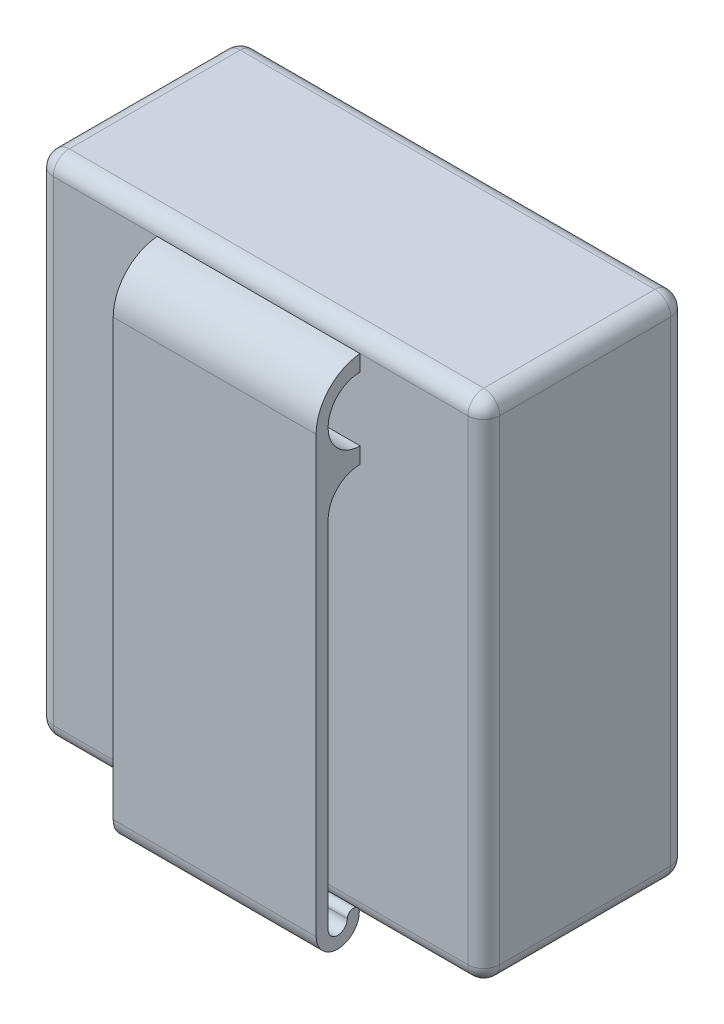
from build123d import *

# Parameters (mm, degrees)
SKETCH1_W           = 55.88
SKETCH1_H           = 63.5
BOSS_EXTRUDE1_DEPTH = 25.4
FILLET1_R           = 2
BOSS_EXTRUDE2_DEPTH = 25.4


with BuildPart() as part:
    # Sketch1 → Boss-Extrude1 (new body)
    with BuildSketch(Plane.XY):
        with Locations((27.94, 31.75)):
            Rectangle(SKETCH1_W, SKETCH1_H)
    extrude(amount=BOSS_EXTRUDE1_DEPTH)

    # Fillet1
    fillet1_edges = [part.edges().sort_by_distance(p)[0] for p in [
        (0, 0, 12.7),
        (55.88, 0, 12.7),
        (27.94, 0, 0),
        (55.88, 31.75, 0),
        (0, 31.75, 0),
        (55.88, 31.75, 25.4),
        (27.94, 0, 25.4),
        (0, 31.75, 25.4),
        (55.88, 63.5, 12.7),
        (27.94, 63.5, 25.4),
        (0, 63.5, 12.7),
        (27.94, 63.5, 0),
    ]]
    fillet(fillet1_edges, radius=FILLET1_R)

    # Sketch3 → Boss-Extrude2 (add)
    with BuildSketch(Plane.ZY.offset(-15)):
        with BuildLine():
            Line((25.4, 61.5), (25.4, 59.5))
            ThreePointArc((25.4, 59.5), (29.4, 55.5), (25.4, 51.5))
            Line((25.4, 51.5), (25.4, 49.5))
            ThreePointArc((25.4, 49.5), (28.228427125, 48.328427125), (29.4, 45.5))
            Line((29.4, 45.5), (29.4, 1.05))
            ThreePointArc((29.4, 1.05), (28.2, -0.15), (27, 1.05))
            ThreePointArc((27, 1.05), (26.25, 1.8), (25.5, 1.05))
            ThreePointArc((25.5, 1.05), (28.2, -1.65), (30.9, 1.05))
            Line((30.9, 1.05), (30.9, 55.5))
            ThreePointArc((30.9, 55.5), (29.316951072, 59.569705149), (25.4, 61.5))
        make_face()
    extrude(amount=-BOSS_EXTRUDE2_DEPTH)


solid = part.part
